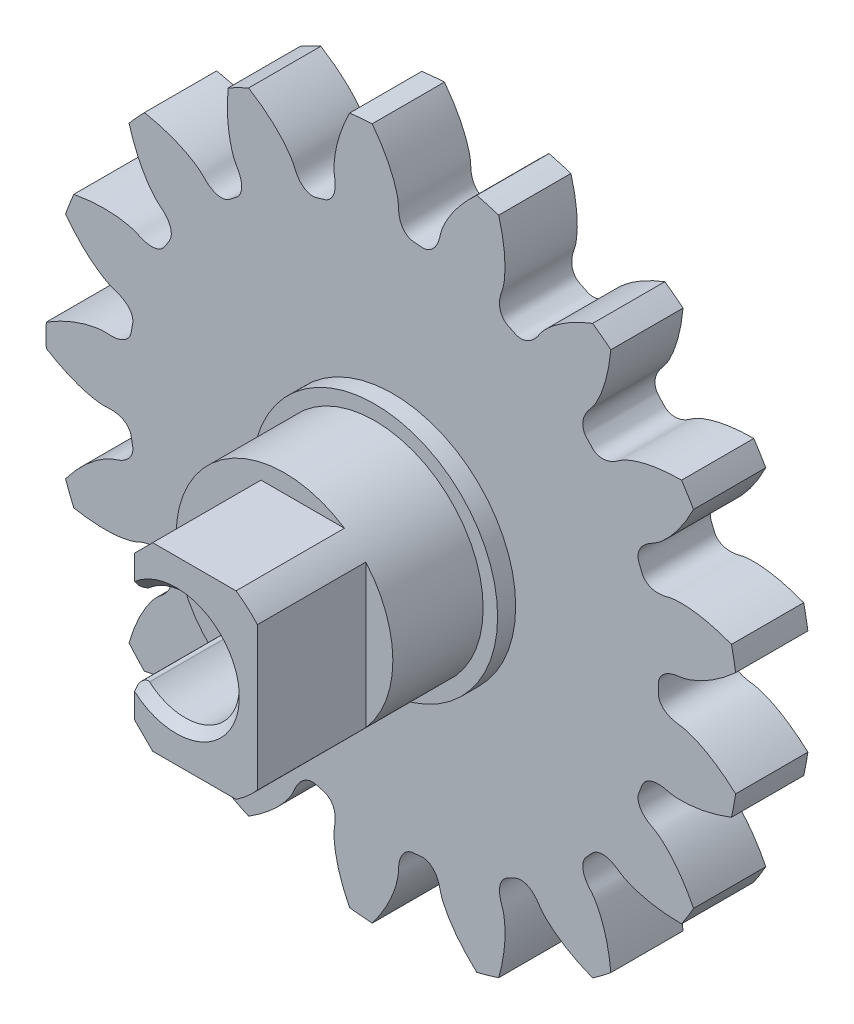
from build123d import *

# Parameters (mm, degrees)
CUT_EXTRUDE_738_DEPTH      = 3
PATTERN_CIRCULAR_794_COUNT = 17
EXTRUDE_1_DEPTH            = 6
CHAMFER_1_SIZE             = 0.5
FILLET_1_R                 = 0.2
CHAMFER_2_SIZE             = 1


with BuildPart() as part:
    # Sketch 320 → Revolve 577 (revolve)
    with BuildSketch(Plane(origin=(0, 0, 0), x_dir=(0, 0, -1), z_dir=(1, 0, 0)), mode=Mode.PRIVATE) as revolve_577_sk:
        Polygon((-2, 19.19999971164493), (-2, 3), (2, 3), (1.9999999999999973, 19.19999971164493), align=None)
    revolve(revolve_577_sk.sketch.rotate(Axis((0, 0, 1), (0, 0, -1)), 90), axis=Axis((0, 0, 1), (0, 0, -1)))

    # Sketch 619 → Cut-Extrude 738 (cut, symmetric)
    with BuildSketch(Plane.XY):
        with BuildLine():
            ThreePointArc((19.076271968353012, 2.9953191131088284), (19.3099997099929, 0), (19.076271968353012, -2.9953191131088284))
            add(Edge.make_bspline(
                [(19.076271968353012, -2.9953191131088284), (18.905946848191313, -2.8359272206500465), (18.649678199437147, -2.611083558885089), (18.30259640613997, -2.33729316078011), (18.057730464021336, -2.1572651755718164), (17.822101704651175, -1.9960462040421496), (17.596687353567475, -1.8527899254042752), (17.382417435528264, -1.7266055285750943), (17.18017288950713, -1.6165604859922342), (16.990783832885686, -1.5216827461351894), (16.8150279110898, -1.440963145716283), (16.653628765803084, -1.3733578831771642), (16.507254570571007, -1.317790957552585), (16.376516795852126, -1.2731570040680515), (16.261968709599902, -1.2383231413140108), (16.164105122030595, -1.212134056449998), (16.08335893269496, -1.1934079170758818), (16.020107004050846, -1.180958287195049), (15.932326166440612, -1.1666505834849845), (15.847690690777142, -1.1606543234888307), (15.762202495020365, -1.1480320567214402), (15.711765196255351, -1.1397565124811924), (15.662244161016737, -1.1304651990958554), (15.61360666851209, -1.1202249579685295), (15.565829689757276, -1.10899447537995), (15.518884096650254, -1.0967528428766091), (15.472738789310569, -1.0834643990422135), (15.427359717096667, -1.0690862958460898), (15.382710425935196, -1.053564536479713), (15.338752472803824, -1.0368327124616321), (15.295446262106667, -1.0188096562297773), (15.252752318269014, -0.9993969855299906), (15.210633207442124, -0.9784762863566338), (15.169056338712101, -0.9559060577154365), (15.12799795410608, -0.9315185291226958), (15.08744868697523, -0.9051166076328044), (15.047421133161338, -0.8764713935815878), (15.007959904969857, -0.845320982527214), (14.969154572907838, -0.8113716513151371), (14.931155655854567, -0.7743030070803476), (14.894193277807085, -0.7337791989748119), (14.858597099182342, -0.6894687043966521), (14.824814630246932, -0.6410751547513733), (14.79342276749296, -0.5883807965049859), (14.765126162955918, -0.5313013632987298), (14.740731583517187, -0.4699481096439208), (14.721102322193373, -0.40468167747634715), (14.707050180310208, -0.33615795611833965), (14.699870130743006, -0.27019464684275035), (14.696990110872006, -0.15788749922577053), (14.702359418207228, -1e-17), (14.696990110872003, 0.15788749922577064), (14.69987013074301, 0.2701946468427499), (14.707050180310203, 0.3361579561183406), (14.721102322193378, 0.40468167747634615), (14.740731583517185, 0.4699481096439223), (14.765126162955918, 0.5313013632987282), (14.79342276749296, 0.5883807965049871), (14.824814630246928, 0.6410751547513727), (14.858597099182342, 0.6894687043966526), (14.894193277807085, 0.7337791989748116), (14.931155655854562, 0.774303007080347), (14.969154572907842, 0.8113716513151383), (15.007959904969853, 0.8453209825272128), (15.04742113316134, 0.8764713935815882), (15.087448686975225, 0.9051166076328043), (15.12799795410608, 0.9315185291226958), (15.169056338712101, 0.955906057715437), (15.21063320744212, 0.9784762863566329), (15.252752318269017, 0.9993969855299915), (15.295446262106664, 1.0188096562297766), (15.338752472803826, 1.0368327124616323), (15.382710425935196, 1.0535645364797133), (15.427359717096666, 1.0690862958460896), (15.472738789310574, 1.0834643990422135), (15.518884096650252, 1.0967528428766093), (15.565829689757276, 1.1089944753799497), (15.61360666851209, 1.12022495796853), (15.662244161016734, 1.130465199095855), (15.711765196255351, 1.1397565124811926), (15.762202495020368, 1.1480320567214402), (15.847690690777139, 1.1606543234888311), (15.932326166440612, 1.1666505834849845), (16.020107004050843, 1.1809582871950488), (16.083358932694967, 1.193407917075882), (16.164105122030588, 1.212134056449998), (16.261968709599905, 1.2383231413140106), (16.376516795852122, 1.2731570040680524), (16.50725457057101, 1.3177909575525846), (16.65362876580308, 1.3733578831771645), (16.815027911089803, 1.4409631457162828), (16.990783832885683, 1.5216827461351896), (17.18017288950713, 1.616560485992234), (17.382417435528264, 1.7266055285750948), (17.596687353567475, 1.8527899254042752), (17.822101704651175, 1.9960462040421483), (18.057730464021336, 2.1572651755718173), (18.302596406139973, 2.33729316078011), (18.649678199437144, 2.6110835588850887), (18.905946848191313, 2.835927220650046), (19.076271968353012, 2.9953191131088284)],
                knots=[0, 0, 0, 0, 0.06229405320540314, 0.09098210408033353, 0.11803083780656684, 0.14344025438703537, 0.16721035382527874, 0.1893411361256223, 0.20983260129343018, 0.228684749335466, 0.2458975802604252, 0.2614710940797494, 0.27540529080891857, 0.2877001704696047, 0.2983557330934822, 0.3073719787295015, 0.3147489074592482, 0.32048651943423795, 0.3245848149878041, 0.3384923545782629, 0.3431096866071886, 0.34765796428485285, 0.35214112806673914, 0.35656355874459017, 0.36093013511351796, 0.36524629947823384, 0.3695181318057672, 0.37375243323202956, 0.37795681939665354, 0.38213982363748356, 0.38631100930911505, 0.3904810892346278, 0.39466204832393165, 0.39886726237860576, 0.4031116016384506, 0.4074115012097168, 0.4117849716257208, 0.41625151104801944, 0.42083186614626417, 0.42554757279856875, 0.4304201939898447, 0.43547016790441173, 0.44071519643845336, 0.44616816009001964, 0.4518346563959406, 0.45771043087217694, 0.4637791755662888, 0.47001133576030923, 0.47636457277282396, 0.4814693618124155, 0.5000000000000001, 0.5185306381875847, 0.5236354272271763, 0.5299886642396909, 0.5362208244337114, 0.5422895691278232, 0.5481653436040597, 0.5538318399099805, 0.5592848035615469, 0.5645298320955885, 0.5695798060101556, 0.5744524272014315, 0.579168133853736, 0.5837484889519808, 0.5882150283742794, 0.5925884987902834, 0.5968883983615496, 0.6011327376213944, 0.6053379516760686, 0.6095189107653723, 0.6136889906908852, 0.6178601763625167, 0.6220431806033466, 0.6262475667679707, 0.630481868194233, 0.6347537005217664, 0.6390698648864823, 0.64343644125541, 0.6478588719332611, 0.6523420357151474, 0.6568903133928116, 0.6615076454217373, 0.6754151850121961, 0.6795134805657622, 0.6852510925407519, 0.6926280212704986, 0.7016442669065179, 0.7122998295303954, 0.7245947091910817, 0.7385289059202509, 0.7541024197395751, 0.7713152506645342, 0.79016739870657, 0.8106588638743778, 0.8327896461747214, 0.8565597456129648, 0.8819691621934331, 0.9090178959196665, 0.937705946794597, 1, 1, 1, 1], degree=3))
        make_face()
    cut_extrude_738 = extrude(amount=CUT_EXTRUDE_738_DEPTH, both=True, mode=Mode.SUBTRACT)

    # Pattern Circular 794: Cut-Extrude 738 ×17 about axis
    pattern_circular_794_axis = Axis((0, 0, 55.00000000000001), (0, 0, -1))
    for i in range(1, PATTERN_CIRCULAR_794_COUNT):
        add(cut_extrude_738.rotate(pattern_circular_794_axis, i * 360 / PATTERN_CIRCULAR_794_COUNT), mode=Mode.SUBTRACT)

    # 草图6 → 旋转2 (revolve)
    with BuildSketch(Plane(origin=(0, 0, 0), x_dir=(0, 0, -1), z_dir=(1, 0, 0)), mode=Mode.PRIVATE) as revolve_2_sk:
        Polygon((-2, 3), (-2, 6.8), (-3, 6.799999999999999), (-3, 6), (-8, 6), (-8, 3), align=None)
    revolve(revolve_2_sk.sketch.rotate(Axis((0, 0, 17.589608089409126), (0, 0, -1)), 90), axis=Axis((0, 0, 17.589608089409126), (0, 0, -1)))

    # 草图7 → 凸台-拉伸1 (add)
    with BuildSketch(Plane.XY.offset(8)):
        with BuildLine():
            Line((-2.3, -1.9261360284259492), (-2.3, -5.000000000000003))
            Line((-2.3, -5.000000000000003), (3.3166247903552444, -5.000000000000003))
            ThreePointArc((3.3166247903552657, -5.000000000000088), (3.942187002389262, -4.523180478180498), (4.499999999999975, -3.9686269665969123))
            Line((4.500000000000001, -3.9686269665969203), (4.500000000000001, 3.9686269665969176))
            ThreePointArc((4.499999999999978, 3.96862696659691), (3.942187002389267, 4.523180478180493), (3.316624790355271, 5.000000000000084))
            Line((3.316624790355248, 4.999999999999997), (-2.3, 4.999999999999997))
            Line((-2.3, 4.999999999999997), (-2.3, 1.9261360284259492))
            ThreePointArc((-2.2999999999999154, 1.9261360284259235), (1.0246950765960217, 2.8195744359743142), (3, 0))
            ThreePointArc((3, -7.3e-16), (1.0246950765960205, -2.8195744359743147), (-2.299999999999916, -1.9261360284259226))
        make_face()
    extrude(amount=EXTRUDE_1_DEPTH)

    # 倒角1
    chamfer_1_edges = [part.edges().sort_by_distance(p)[0] for p in [
        (3.0000000000000004, -7.8e-16, 14),
    ]]
    chamfer(chamfer_1_edges, length=CHAMFER_1_SIZE)

    # 圆角1
    # the kernel refuses this fillet: 0.2 mm, written as the material it takes off along each edge
    with BuildSketch(Plane(origin=(-2.2999999999999576, 1.9261360284259363, 8), x_dir=(0.7004734680512468, 0.7136784433876779, 0), z_dir=(0, 0, 1))) as fillet_1_piece_1:
        with BuildLine():
            CenterArc((0.48865757559509604, 0.19937784023743985), FILLET_1_R, 134.46500276204804, 131.0144996657306)
            Line((0.34856288198484686, 0.3421135289149759), (0, 0))
            ThreePointArc((0, 0), (0.23644721399763363, 0.0093323964384009), (0.4728944279952707, -1e-17))
        make_face()
    extrude(amount=6.721008162759979, mode=Mode.SUBTRACT)
    with BuildSketch(Plane(origin=(-2.2999999999999576, -1.9261360284259361, 8), x_dir=(0.7004734680512474, -0.7136784433876772, 0), z_dir=(0, 0, 1))) as fillet_1_piece_2:
        with BuildLine():
            CenterArc((0.48865757559509654, -0.19937784023743985), FILLET_1_R, 94.52049757222129, 131.01449966573074)
            Line((0.3485628819848476, -0.34211352891497604), (0, 0))
            ThreePointArc((0, 0), (0.23644721399763408, -0.00933239643840098), (0.4728944279952714, -1e-17))
        make_face()
    extrude(amount=6.721008162759983, mode=Mode.SUBTRACT)

    # 倒角2
    chamfer_2_edges = [part.edges().sort_by_distance(p)[0] for p in [
        (-2.3, 4.999999999999997, 11),
        (-2.3, -5.000000000000003, 11),
    ]]
    chamfer(chamfer_2_edges, length=CHAMFER_2_SIZE)


solid = part.part
